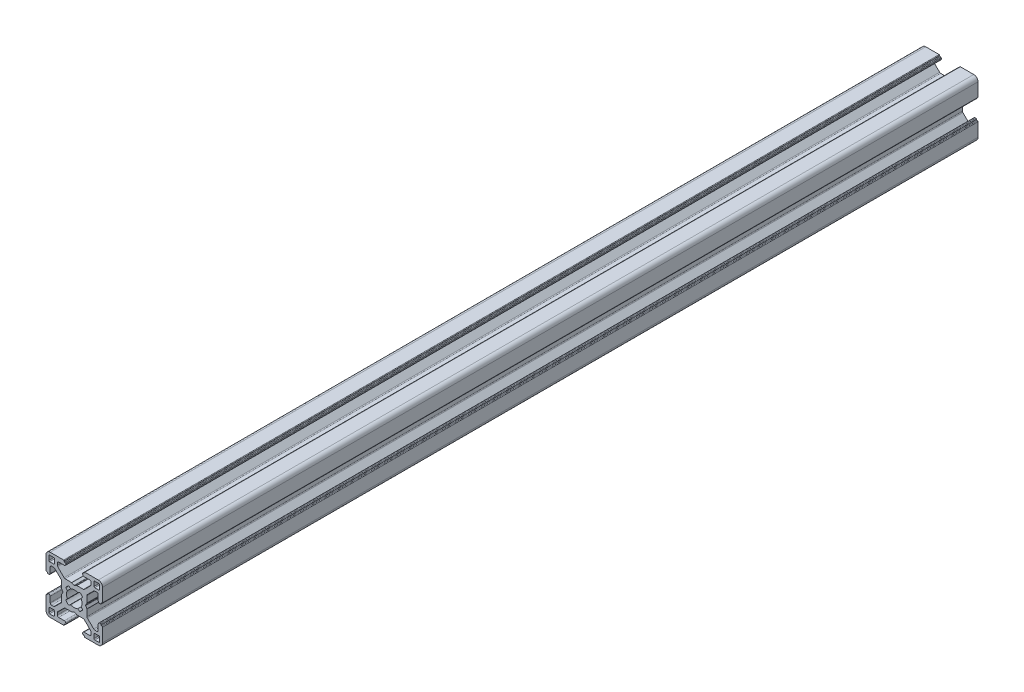
from build123d import *

# Parameters (mm, degrees)
ESTRUSIONE_ESTRUSIONE1_DEPTH = 310


with BuildPart() as part:
    # Schizzo1 → Estrusione-Estrusione1 (new body)
    with BuildSketch(Plane.XY.offset(100)):
        with BuildLine():
            Line((-9.299999732, 3), (-8.999999732, 3))
            ThreePointArc((-8.999999732, 3), (-8.646446341, 3.146446609), (-8.499999732, 3.5))
            Line((-8.499999732, 3.5), (-8.499999732, 5.499999605))
            ThreePointArc((-8.499999732, 5.499999605), (-8.353553123, 5.853552995), (-7.999999732, 5.999999605))
            Line((-7.999999732, 5.999999605), (-7.267766685, 5.999999605))
            ThreePointArc((-7.267766685, 5.999999605), (-7.076424969, 5.961939371), (-6.914213294, 5.853552995))
            Line((-6.914213294, 5.853552995), (-4.646446398, 3.585786099))
            ThreePointArc((-4.646446398, 3.585786099), (-4.538060023, 3.423574425), (-4.499999789, 3.232232708))
            Line((-4.499999789, 3.232232708), (-4.499999789, 0.953589302))
            ThreePointArc((-4.499999789, 0.953589302), (-4.493184953, 0.90182549), (-4.473204867, 0.853589297))
            Line((-4.473204867, 0.853589297), (-4.038119841, 0.099999969))
            ThreePointArc((-4.038119841, 0.099999969), (-4.011324929, 0), (-4.038119841, -0.099999969))
            Line((-4.038119841, -0.099999969), (-4.473204867, -0.853589297))
            ThreePointArc((-4.473204867, -0.853589297), (-4.493184953, -0.90182549), (-4.499999789, -0.953589302))
            Line((-4.499999789, -0.953589302), (-4.499999789, -3.232232708))
            ThreePointArc((-4.499999789, -3.232232708), (-4.538060023, -3.423574425), (-4.646446398, -3.585786099))
            Line((-4.646446398, -3.585786099), (-6.914213294, -5.853552995))
            ThreePointArc((-6.914213294, -5.853552995), (-7.076424969, -5.961939371), (-7.267766685, -5.999999605))
            Line((-7.267766685, -5.999999605), (-7.999999732, -5.999999605))
            ThreePointArc((-7.999999732, -5.999999605), (-8.353553123, -5.853552995), (-8.499999732, -5.499999605))
            Line((-8.499999732, -5.499999605), (-8.499999732, -3.5))
            ThreePointArc((-8.499999732, -3.5), (-8.646446341, -3.146446609), (-8.999999732, -3))
            Line((-8.999999732, -3), (-9.299999732, -3))
            ThreePointArc((-9.299999732, -3), (-9.441421088, -3.058578644), (-9.499999732, -3.2))
            Line((-9.499999732, -3.2), (-9.499999732, -3.349999605))
            ThreePointArc((-9.499999732, -3.349999605), (-9.558578376, -3.491420961), (-9.699999732, -3.549999605))
            Line((-9.699999732, -3.549999605), (-9.8, -3.549999605))
            ThreePointArc((-9.8, -3.549999605), (-9.941421356, -3.608578248), (-10, -3.749999605))
            Line((-10, -3.749999605), (-10, -8.5))
            ThreePointArc((-10, -8.5), (-9.560660172, -9.560660172), (-8.5, -10))
            Line((-8.5, -10), (-3.750000228, -10))
            ThreePointArc((-3.750000228, -10), (-3.608578871, -9.941421356), (-3.550000228, -9.8))
            Line((-3.550000228, -9.8), (-3.550000228, -9.7))
            ThreePointArc((-3.550000228, -9.7), (-3.491421584, -9.558578644), (-3.350000228, -9.5))
            Line((-3.350000228, -9.5), (-3.2, -9.5))
            ThreePointArc((-3.2, -9.5), (-3.058578644, -9.441421356), (-3, -9.3))
            Line((-3, -9.3), (-3, -8.999999673))
            ThreePointArc((-3, -8.999999673), (-3.146446609, -8.646446283), (-3.5, -8.499999673))
            Line((-3.5, -8.499999673), (-5.500000686, -8.499999673))
            ThreePointArc((-5.500000686, -8.499999673), (-5.853554077, -8.353553064), (-6.000000686, -7.999999673))
            Line((-6.000000686, -7.999999673), (-6.000000686, -7.267766626))
            ThreePointArc((-6.000000686, -7.267766626), (-5.961940448, -7.076424899), (-5.853554059, -6.914213219))
            Line((-5.853554059, -6.914213219), (-3.585787212, -4.646446592))
            ThreePointArc((-3.585787212, -4.646446592), (-3.423575544, -4.538060229), (-3.232233839, -4.5))
            Line((-3.232233839, -4.5), (-0.953590312, -4.5))
            ThreePointArc((-0.953590312, -4.5), (-0.901826505, -4.493185166), (-0.853590316, -4.473205083))
            Line((-0.853590316, -4.473205083), (-0.100000045, -4.038119562))
            ThreePointArc((-0.100000045, -4.038119562), (0, -4.011324632), (0.100000045, -4.038119562))
            Line((0.100000045, -4.038119562), (0.853590316, -4.473205083))
            ThreePointArc((0.853590316, -4.473205083), (0.901826505, -4.493185166), (0.953590312, -4.5))
            Line((0.953590312, -4.5), (3.23223292, -4.5))
            ThreePointArc((3.23223292, -4.5), (3.423574636, -4.538060234), (3.58578631, -4.646446609))
            Line((3.58578631, -4.646446609), (5.853554077, -6.914214376))
            ThreePointArc((5.853554077, -6.914214376), (5.961940452, -7.07642605), (6.000000686, -7.267767766))
            Line((6.000000686, -7.267767766), (6.000000686, -7.999999673))
            ThreePointArc((6.000000686, -7.999999673), (5.853554077, -8.353553064), (5.500000686, -8.499999673))
            Line((5.500000686, -8.499999673), (3.5, -8.499999673))
            ThreePointArc((3.5, -8.499999673), (3.146446609, -8.646446283), (3, -8.999999673))
            Line((3, -8.999999673), (3, -9.3))
            ThreePointArc((3, -9.3), (3.058578644, -9.441421356), (3.2, -9.5))
            Line((3.2, -9.5), (3.350000228, -9.5))
            ThreePointArc((3.350000228, -9.5), (3.491421584, -9.558578644), (3.550000228, -9.7))
            Line((3.550000228, -9.7), (3.550000228, -9.8))
            ThreePointArc((3.550000228, -9.8), (3.608578871, -9.941421356), (3.750000228, -10))
            Line((3.750000228, -10), (8.5, -10))
            ThreePointArc((8.5, -10), (9.560660172, -9.560660172), (10, -8.5))
            Line((10, -8.5), (10, -3.749999605))
            ThreePointArc((10, -3.749999605), (9.941421356, -3.608578248), (9.8, -3.549999605))
            Line((9.8, -3.549999605), (9.699999732, -3.549999605))
            ThreePointArc((9.699999732, -3.549999605), (9.558578376, -3.491420961), (9.499999732, -3.349999605))
            Line((9.499999732, -3.349999605), (9.499999732, -3.2))
            ThreePointArc((9.499999732, -3.2), (9.441421088, -3.058578644), (9.299999732, -3))
            Line((9.299999732, -3), (8.999999732, -3))
            ThreePointArc((8.999999732, -3), (8.646446341, -3.146446609), (8.499999732, -3.5))
            Line((8.499999732, -3.5), (8.499999732, -5.499999605))
            ThreePointArc((8.499999732, -5.499999605), (8.353553123, -5.853552995), (7.999999732, -5.999999605))
            Line((7.999999732, -5.999999605), (7.267766789, -5.999999605))
            ThreePointArc((7.267766789, -5.999999605), (7.076425084, -5.961939376), (6.914213416, -5.853553012))
            Line((6.914213416, -5.853553012), (4.646446415, -3.585786233))
            ThreePointArc((4.646446415, -3.585786233), (4.538060027, -3.423574553), (4.499999789, -3.232232825))
            Line((4.499999789, -3.232232825), (4.499999789, -0.953589302))
            ThreePointArc((4.499999789, -0.953589302), (4.493184953, -0.90182549), (4.473204867, -0.853589297))
            Line((4.473204867, -0.853589297), (4.038119841, -0.099999969))
            ThreePointArc((4.038119841, -0.099999969), (4.011324929, 0), (4.038119841, 0.099999969))
            Line((4.038119841, 0.099999969), (4.473204867, 0.853589297))
            ThreePointArc((4.473204867, 0.853589297), (4.493184953, 0.90182549), (4.499999789, 0.953589302))
            Line((4.499999789, 0.953589302), (4.499999789, 3.232232825))
            ThreePointArc((4.499999789, 3.232232825), (4.538060027, 3.423574553), (4.646446415, 3.585786233))
            Line((4.646446415, 3.585786233), (6.914213416, 5.853553012))
            ThreePointArc((6.914213416, 5.853553012), (7.076425084, 5.961939376), (7.267766789, 5.999999605))
            Line((7.267766789, 5.999999605), (7.999999732, 5.999999605))
            ThreePointArc((7.999999732, 5.999999605), (8.353553123, 5.853552995), (8.499999732, 5.499999605))
            Line((8.499999732, 5.499999605), (8.499999732, 3.5))
            ThreePointArc((8.499999732, 3.5), (8.646446341, 3.146446609), (8.999999732, 3))
            Line((8.999999732, 3), (9.299999732, 3))
            ThreePointArc((9.299999732, 3), (9.441421088, 3.058578644), (9.499999732, 3.2))
            Line((9.499999732, 3.2), (9.499999732, 3.349999605))
            ThreePointArc((9.499999732, 3.349999605), (9.558578376, 3.491420961), (9.699999732, 3.549999605))
            Line((9.699999732, 3.549999605), (9.8, 3.549999605))
            ThreePointArc((9.8, 3.549999605), (9.941421356, 3.608578248), (10, 3.749999605))
            Line((10, 3.749999605), (10, 8.5))
            ThreePointArc((10, 8.5), (9.560660172, 9.560660172), (8.5, 10))
            Line((8.5, 10), (3.750000228, 10))
            ThreePointArc((3.750000228, 10), (3.608578871, 9.941421356), (3.550000228, 9.8))
            Line((3.550000228, 9.8), (3.550000228, 9.7))
            ThreePointArc((3.550000228, 9.7), (3.491421584, 9.558578644), (3.350000228, 9.5))
            Line((3.350000228, 9.5), (3.2, 9.5))
            ThreePointArc((3.2, 9.5), (3.058578644, 9.441421356), (3, 9.3))
            Line((3, 9.3), (3, 8.999999673))
            ThreePointArc((3, 8.999999673), (3.146446609, 8.646446283), (3.5, 8.499999673))
            Line((3.5, 8.499999673), (5.500000686, 8.499999673))
            ThreePointArc((5.500000686, 8.499999673), (5.853554077, 8.353553064), (6.000000686, 7.999999673))
            Line((6.000000686, 7.999999673), (6.000000686, 7.267767766))
            ThreePointArc((6.000000686, 7.267767766), (5.961940452, 7.07642605), (5.853554077, 6.914214376))
            Line((5.853554077, 6.914214376), (3.58578631, 4.646446609))
            ThreePointArc((3.58578631, 4.646446609), (3.423574636, 4.538060234), (3.23223292, 4.5))
            Line((3.23223292, 4.5), (0.953590312, 4.5))
            ThreePointArc((0.953590312, 4.5), (0.901826505, 4.493185166), (0.853590316, 4.473205083))
            Line((0.853590316, 4.473205083), (0.100000045, 4.038119562))
            ThreePointArc((0.100000045, 4.038119562), (0, 4.011324632), (-0.100000045, 4.038119562))
            Line((-0.100000045, 4.038119562), (-0.853590316, 4.473205083))
            ThreePointArc((-0.853590316, 4.473205083), (-0.901826505, 4.493185166), (-0.953590312, 4.5))
            Line((-0.953590312, 4.5), (-3.232233839, 4.5))
            ThreePointArc((-3.232233839, 4.5), (-3.423575544, 4.538060229), (-3.585787212, 4.646446592))
            Line((-3.585787212, 4.646446592), (-5.853554059, 6.914213219))
            ThreePointArc((-5.853554059, 6.914213219), (-5.961940448, 7.076424899), (-6.000000686, 7.267766626))
            Line((-6.000000686, 7.267766626), (-6.000000686, 7.999999673))
            ThreePointArc((-6.000000686, 7.999999673), (-5.853554077, 8.353553064), (-5.500000686, 8.499999673))
            Line((-5.500000686, 8.499999673), (-3.5, 8.499999673))
            ThreePointArc((-3.5, 8.499999673), (-3.146446609, 8.646446283), (-3, 8.999999673))
            Line((-3, 8.999999673), (-3, 9.3))
            ThreePointArc((-3, 9.3), (-3.058578644, 9.441421356), (-3.2, 9.5))
            Line((-3.2, 9.5), (-3.350000228, 9.5))
            ThreePointArc((-3.350000228, 9.5), (-3.491421584, 9.558578644), (-3.550000228, 9.7))
            Line((-3.550000228, 9.7), (-3.550000228, 9.8))
            ThreePointArc((-3.550000228, 9.8), (-3.608578871, 9.941421356), (-3.750000228, 10))
            Line((-3.750000228, 10), (-8.5, 10))
            ThreePointArc((-8.5, 10), (-9.560660172, 9.560660172), (-10, 8.5))
            Line((-10, 8.5), (-10, 3.749999605))
            ThreePointArc((-10, 3.749999605), (-9.941421356, 3.608578248), (-9.8, 3.549999605))
            Line((-9.8, 3.549999605), (-9.699999732, 3.549999605))
            ThreePointArc((-9.699999732, 3.549999605), (-9.558578376, 3.491420961), (-9.499999732, 3.349999605))
            Line((-9.499999732, 3.349999605), (-9.499999732, 3.2))
            ThreePointArc((-9.499999732, 3.2), (-9.441421088, 3.058578644), (-9.299999732, 3))
        make_face()
        with BuildLine():
            Line((-1.91389502, 2.989640962), (-1.258185436, 2.445295362))
            ThreePointArc((-1.258185436, 2.445295362), (0, 2.75), (1.258185436, 2.445295362))
            Line((1.258185436, 2.445295362), (1.91389502, 2.989640962))
            ThreePointArc((1.91389502, 2.989640962), (2.511737261, 2.508410485), (2.992174953, 1.909930962))
            Line((2.992174953, 1.909930962), (2.445295423, 1.258185317))
            ThreePointArc((2.445295423, 1.258185317), (2.75, 0), (2.445295423, -1.258185317))
            Line((2.445295423, -1.258185317), (2.992174953, -1.909930962))
            ThreePointArc((2.992174953, -1.909930962), (2.511737261, -2.508410485), (1.91389502, -2.989640962))
            Line((1.91389502, -2.989640962), (1.258185436, -2.445295362))
            ThreePointArc((1.258185436, -2.445295362), (0, -2.75), (-1.258185436, -2.445295362))
            Line((-1.258185436, -2.445295362), (-1.91389502, -2.989640962))
            ThreePointArc((-1.91389502, -2.989640962), (-2.511737261, -2.508410485), (-2.992174953, -1.909930962))
            Line((-2.992174953, -1.909930962), (-2.445295423, -1.258185317))
            ThreePointArc((-2.445295423, -1.258185317), (-2.75, 0), (-2.445295423, 1.258185317))
            Line((-2.445295423, 1.258185317), (-2.992174953, 1.909930962))
            ThreePointArc((-2.992174953, 1.909930962), (-2.511737261, 2.508410485), (-1.91389502, 2.989640962))
        make_face(mode=Mode.SUBTRACT)
        with BuildLine():
            Line((8.699999314, 7.000000686), (7.3, 7.000000686))
            ThreePointArc((7.3, 7.000000686), (7.087867966, 7.087868652), (7, 7.300000686))
            Line((7, 7.300000686), (7, 8.7))
            ThreePointArc((7, 8.7), (7.087867966, 8.912132034), (7.3, 9))
            Line((7.3, 9), (8.699999314, 9))
            ThreePointArc((8.699999314, 9), (8.912131348, 8.912132034), (8.999999314, 8.7))
            Line((8.999999314, 8.7), (8.999999314, 7.300000686))
            ThreePointArc((8.999999314, 7.300000686), (8.912131348, 7.087868652), (8.699999314, 7.000000686))
        make_face(mode=Mode.SUBTRACT)
        with BuildLine():
            Line((-7.300000686, 7.000000686), (-8.7, 7.000000686))
            ThreePointArc((-8.7, 7.000000686), (-8.912132034, 7.087868652), (-9, 7.300000686))
            Line((-9, 7.300000686), (-9, 8.7))
            ThreePointArc((-9, 8.7), (-8.912132034, 8.912132034), (-8.7, 9))
            Line((-8.7, 9), (-7.300000686, 9))
            ThreePointArc((-7.300000686, 9), (-7.087868652, 8.912132034), (-7.000000686, 8.7))
            Line((-7.000000686, 8.7), (-7.000000686, 7.300000686))
            ThreePointArc((-7.000000686, 7.300000686), (-7.087868652, 7.087868652), (-7.300000686, 7.000000686))
        make_face(mode=Mode.SUBTRACT)
        with BuildLine():
            Line((8.699999314, -8.999999314), (7.3, -8.999999314))
            ThreePointArc((7.3, -8.999999314), (7.087867966, -8.912131348), (7, -8.699999314))
            Line((7, -8.699999314), (7, -7.3))
            ThreePointArc((7, -7.3), (7.087867966, -7.087867966), (7.3, -7))
            Line((7.3, -7), (8.699999314, -7))
            ThreePointArc((8.699999314, -7), (8.912131348, -7.087867966), (8.999999314, -7.3))
            Line((8.999999314, -7.3), (8.999999314, -8.699999314))
            ThreePointArc((8.999999314, -8.699999314), (8.912131348, -8.912131348), (8.699999314, -8.999999314))
        make_face(mode=Mode.SUBTRACT)
        with BuildLine():
            Line((-7.300000686, -8.999999314), (-8.7, -8.999999314))
            ThreePointArc((-8.7, -8.999999314), (-8.912132034, -8.912131348), (-9, -8.699999314))
            Line((-9, -8.699999314), (-9, -7.3))
            ThreePointArc((-9, -7.3), (-8.912132034, -7.087867966), (-8.7, -7))
            Line((-8.7, -7), (-7.300000686, -7))
            ThreePointArc((-7.300000686, -7), (-7.087868652, -7.087867966), (-7.000000686, -7.3))
            Line((-7.000000686, -7.3), (-7.000000686, -8.699999314))
            ThreePointArc((-7.000000686, -8.699999314), (-7.087868652, -8.912131348), (-7.300000686, -8.999999314))
        make_face(mode=Mode.SUBTRACT)
    extrude(amount=-ESTRUSIONE_ESTRUSIONE1_DEPTH)


solid = part.part
